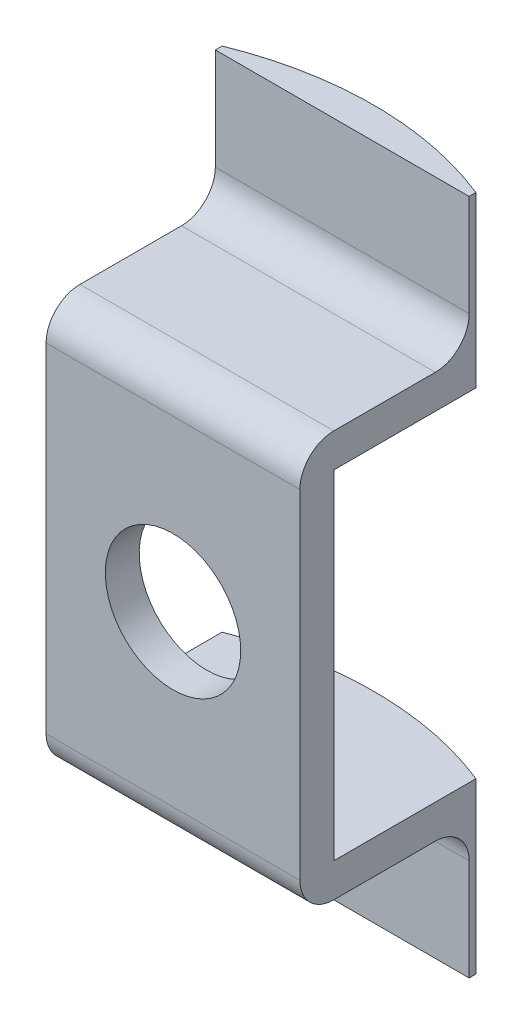
from build123d import *

# Parameters (mm, degrees)
BOSS_EXTRUDE1_DEPTH = 15
SKETCH2_R           = 4
CUT_EXTRUDE1_DEPTH  = 15
CUT_EXTRUDE2_DEPTH  = 45.373415465
FILLET1_R           = 2
FILLET2_R           = 2


with BuildPart() as part:
    # Sketch1 → Boss-Extrude1 (new body)
    with BuildSketch(Plane.YZ):
        Polygon((-20, 0), (-10, 0), (-10, 10), (10, 10), (10, 0), (20, 0), (20, 2), (12, 2), (12, 12), (-12, 12), (-12, 2), (-20, 2), align=None)
    extrude(amount=BOSS_EXTRUDE1_DEPTH)

    # Sketch2 → Cut-Extrude1 (cut)
    with BuildSketch(Plane.XY.offset(12)):
        with Locations((7.5, 0)):
            Circle(SKETCH2_R)
    extrude(amount=-CUT_EXTRUDE1_DEPTH, mode=Mode.SUBTRACT)

    # Sketch3 → Cut-Extrude2 (cut, through all)
    with BuildSketch(Plane(origin=(0, 20, 0), x_dir=(-1, 0, 0), z_dir=(0, 1, 0))):
        with BuildLine():
            Line((-15, 1.6), (-15, -1.040698903))
            Line((-15, -1.040698903), (0, -1.091327241))
            Line((0, -1.091327241), (0, 1.6))
            ThreePointArc((0, 1.6), (-7.5, 0.140496218), (-15, 1.6))
        make_face()
    extrude(amount=-CUT_EXTRUDE2_DEPTH, mode=Mode.SUBTRACT)

    # Fillet1
    fillet1_edges = [part.edges().sort_by_distance(p)[0] for p in [
        (7.5, -12, 2),
        (7.5, 12, 2),
    ]]
    fillet(fillet1_edges, radius=FILLET1_R)

    # Fillet2
    fillet2_edges = [part.edges().sort_by_distance(p)[0] for p in [
        (7.5, 12, 12),
        (7.5, -12, 12),
    ]]
    fillet(fillet2_edges, radius=FILLET2_R)


solid = part.part
